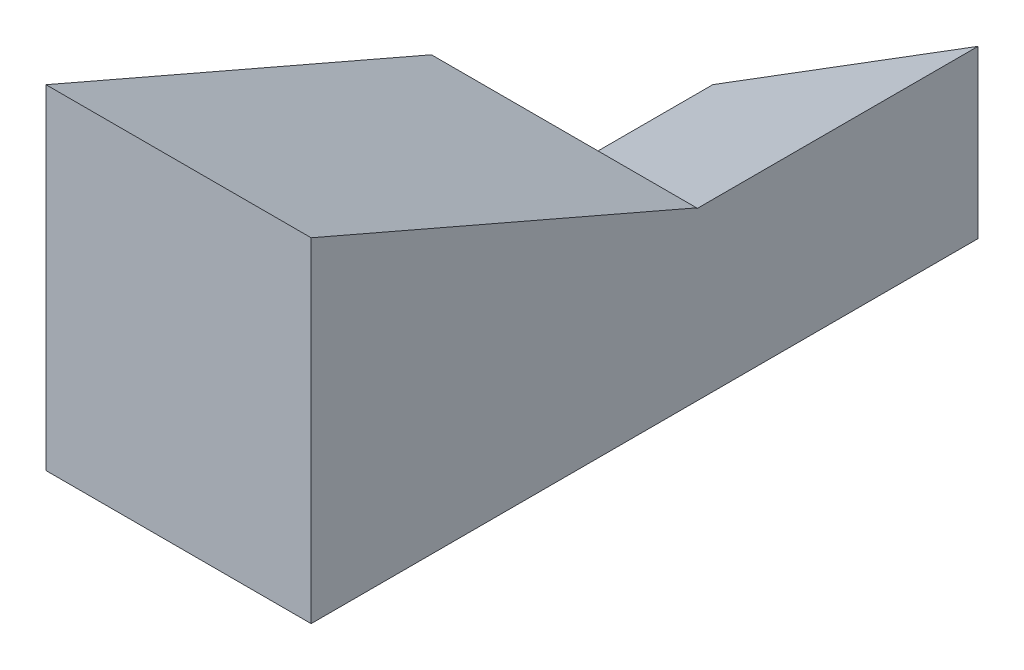
from build123d import *

# Parameters (mm, degrees)
SKETCH2_W           = 40
SKETCH2_H           = 5
SKETCH2_W_2         = 5
SKETCH2_H_2         = 100
BOSS_EXTRUDE1_DEPTH = 30
SKETCH3_W           = 3
SKETCH3_H           = 3
CUT_EXTRUDE1_DEPTH  = 5
SKETCH2_4_W         = 40
SKETCH2_4_H         = 100
BOSS_EXTRUDE2_DEPTH = 5
CUT_EXTRUDE2_DEPTH  = 25
BOSS_EXTRUDE3_DEPTH = 25
SKETCH10_W          = 40
SKETCH10_H          = 5
BOSS_EXTRUDE4_DEPTH = 35
SKETCH11_W          = 5
SKETCH11_H          = 5
CUT_EXTRUDE5_DEPTH  = 6
SKETCH11_4_W        = 5
SKETCH11_4_H        = 5
CUT_EXTRUDE6_DEPTH  = 4.99
BOSS_EXTRUDE5_DEPTH = 50
SKETCH12_3_W        = 40
SKETCH12_3_H        = 42.17911114
BOSS_EXTRUDE6_DEPTH = 25
CHAMFER1_SIZE       = 25.021332939
CHAMFER1_SIZE_2     = 57.82088886
CUT_EXTRUDE7_DEPTH  = 42.2284
SKETCH15_W          = 50
SKETCH15_H          = 110
CUT_EXTRUDE8_DEPTH  = 40
SKETCH16_W          = 40
SKETCH16_H          = 100
SKETCH16_W_2        = 39.6
SKETCH16_H_2        = 99.6
CUT_EXTRUDE9_DEPTH  = 50


with BuildPart() as part:
    # Sketch2 → Boss-Extrude1 (new body)
    with BuildSketch(Plane(origin=(0, 0, 0), x_dir=(1, 0, 0), z_dir=(0, 1, 0))):
        Polygon((-22.5, 60), (-22.5, -50), (-17.5, -50), (-17.5, -45), (-17.5, 55), (-17.5, 60), align=None)
        with Locations((2.5, 57.5)):
            Rectangle(SKETCH2_W, SKETCH2_H)
        with Locations((25, 57.5)):
            Rectangle(SKETCH2_W_2, SKETCH2_H)
        with Locations((25, 5)):
            Rectangle(SKETCH2_W_2, SKETCH2_H_2)
        with Locations((25, -47.5)):
            Rectangle(SKETCH2_W_2, SKETCH2_H)
        with Locations((2.5, -47.5)):
            Rectangle(SKETCH2_W, SKETCH2_H)
    extrude(amount=-BOSS_EXTRUDE1_DEPTH)

    # Sketch3 → Cut-Extrude1 (cut)
    with BuildSketch(Plane.ZY.offset(22.5)):
        Polygon((-35, -25), (-35, -28), (-32, -28), (-32, -22), (-38, -22), (-38, -25), align=None)
        with Locations((-36.5, -26.5)):
            Rectangle(SKETCH3_W, SKETCH3_H)
    extrude(amount=-CUT_EXTRUDE1_DEPTH, mode=Mode.SUBTRACT)

    # Sketch2<4> → Boss-Extrude2 (add)
    with BuildSketch(Plane(origin=(0, 0, 0), x_dir=(1, 0, 0), z_dir=(0, 1, 0))):
        with Locations((2.5, 5)):
            Rectangle(SKETCH2_4_W, SKETCH2_4_H)
    extrude(amount=-BOSS_EXTRUDE2_DEPTH)

    # Sketch5 → Cut-Extrude2 (cut)
    with BuildSketch(Plane.XZ.offset(30)):
        Polygon((27.5, 50), (-22.5, 50), (-22.5, 45), (-17.5, 45), (17.5, 45), (22.5, 45), (22.5, -55), (17.5, -55), (-17.5, -55), (-22.5, -55), (-22.5, -60), (27.5, -60), align=None)
    extrude(amount=-CUT_EXTRUDE2_DEPTH, mode=Mode.SUBTRACT)

    # Sketch5<3> → Boss-Extrude3 (add)
    with BuildSketch(Plane.XZ.offset(30)):
        Polygon((17.5, 45), (-17.5, 45), (-17.5, 40), (12.5, 40), (12.5, -50), (-17.5, -50), (-17.5, -55), (17.5, -55), align=None)
    extrude(amount=-BOSS_EXTRUDE3_DEPTH)

    # Sketch10 → Boss-Extrude4 (add)
    with BuildSketch(Plane.XZ.offset(5)):
        with Locations((-2.5, 47.5)):
            Rectangle(SKETCH10_W, SKETCH10_H)
        with Locations((-2.5, -57.5)):
            Rectangle(SKETCH10_W, SKETCH10_H)
    extrude(amount=BOSS_EXTRUDE4_DEPTH)

    # Sketch11 → Cut-Extrude5 (cut)
    with BuildSketch(Plane(origin=(0, 0, 0), x_dir=(1, 0, 0), z_dir=(0, 1, 0))):
        with Locations((25, 52.5)):
            Rectangle(SKETCH11_W, SKETCH11_H)
        Polygon((27.5, 7.5), (22.5, 7.5), (22.5, 5), (22.5, 2.5), (27.5, 2.5), (27.5, 5), align=None)
        Polygon((27.5, -45), (27.5, -40), (24, -40), (23.5, -40), (22.5, -40), (22.5, -41), (22.5, -41.5), (22.5, -45), align=None)
    extrude(amount=-CUT_EXTRUDE5_DEPTH, mode=Mode.SUBTRACT)

    # Sketch11<4> → Cut-Extrude6 (cut)
    with BuildSketch(Plane(origin=(0, 0, 0), x_dir=(1, 0, 0), z_dir=(0, 1, 0))):
        Polygon((-17.5, 7.5), (-22.5, 7.5), (-22.5, 5), (-22.5, 2.5), (-17.5, 2.5), align=None)
        with Locations((-20, -42.5)):
            Rectangle(SKETCH11_4_W, SKETCH11_4_H)
    extrude(amount=-CUT_EXTRUDE6_DEPTH, mode=Mode.SUBTRACT)

    # Sketch12 → Boss-Extrude5 (add)
    with BuildSketch(Plane(origin=(0, 0, 0), x_dir=(1, 0, 0), z_dir=(0, 1, 0))):
        Polygon((22.5, 12.82088886), (-17.5, 12.82088886), (-17.5, 7.5), (-17.5, 2.5), (-17.5, -40), (-17.5, -45), (22.5, -45), (22.5, -40), (22.5, 2.5), (22.5, 7.5), align=None)
    extrude(amount=BOSS_EXTRUDE5_DEPTH)

    # Sketch12<3> → Boss-Extrude6 (add)
    with BuildSketch(Plane(origin=(0, 0, 0), x_dir=(1, 0, 0), z_dir=(0, 1, 0))):
        with Locations((2.5, 33.91044443)):
            Rectangle(SKETCH12_3_W, SKETCH12_3_H)
    extrude(amount=BOSS_EXTRUDE6_DEPTH)

    # Chamfer1
    # the kernel refuses this chamfer: 57.82088886, 25.021332939 mm, written as the material it takes off along each edge
    with BuildSketch(Plane(origin=(172.37635383, 50, -12.82088886), x_dir=(0, -0.9966687843763375, -0.08155571255156512), z_dir=(-1, 0, 0))) as chamfer1_piece_1_section:
        Polygon((CHAMFER1_SIZE * 0.996668784369, CHAMFER1_SIZE * 0.081555712551), (-CHAMFER1_SIZE_2 * 0.0815557125516, CHAMFER1_SIZE_2 * 0.996668784376), (0, 0), align=None)
    chamfer1_piece_1 = extrude(amount=339.752707661, mode=Mode.PRIVATE)
    chamfer1_piece_1 = split(chamfer1_piece_1, bisect_by=Plane(origin=(2.5, 25, 6.452754758), z_dir=(0, 1, 0)), keep=Keep.TOP, mode=Mode.PRIVATE)
    add(chamfer1_piece_1, mode=Mode.SUBTRACT)

    # Sketch14 → Cut-Extrude7 (cut)
    with BuildSketch(Plane(origin=(0, 0, -55), x_dir=(-1, 0, 0), z_dir=(0, 0, -1))):
        Polygon((-22.5, 25), (17.5, 0), (17.5, 25), align=None)
    extrude(amount=-CUT_EXTRUDE7_DEPTH, mode=Mode.SUBTRACT)

    # Sketch15 → Cut-Extrude8 (cut)
    with BuildSketch(Plane.XZ.offset(40)):
        with Locations((2.5, -5)):
            Rectangle(SKETCH15_W, SKETCH15_H)
    extrude(amount=-CUT_EXTRUDE8_DEPTH, mode=Mode.SUBTRACT)

    # Sketch16 → Cut-Extrude9 (cut)
    with BuildSketch(Plane.XZ):
        with Locations((2.5, -5)):
            Rectangle(SKETCH16_W, SKETCH16_H)
        with Locations((2.5, -5)):
            Rectangle(SKETCH16_W_2, SKETCH16_H_2, mode=Mode.SUBTRACT)
    extrude(amount=-CUT_EXTRUDE9_DEPTH, mode=Mode.SUBTRACT)


solid = part.part
